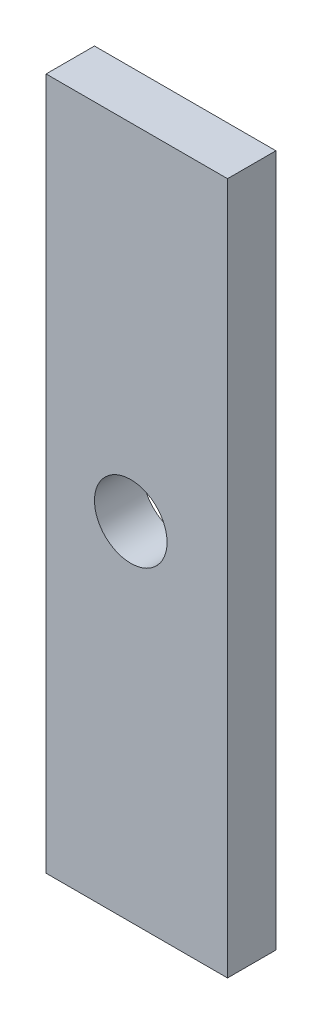
from build123d import *

# Parameters (mm, degrees)
SKETCH1_W           = 7.5
SKETCH1_H           = 28.618561113
SKETCH1_R           = 1.5
BOSS_EXTRUDE1_DEPTH = 2


with BuildPart() as part:
    # Sketch1 → Boss-Extrude1 (new body)
    with BuildSketch(Plane.XY):
        with Locations((0.25, -0.037311462)):
            Rectangle(SKETCH1_W, SKETCH1_H)
        Circle(SKETCH1_R, mode=Mode.SUBTRACT)
    extrude(amount=BOSS_EXTRUDE1_DEPTH)


solid = part.part
